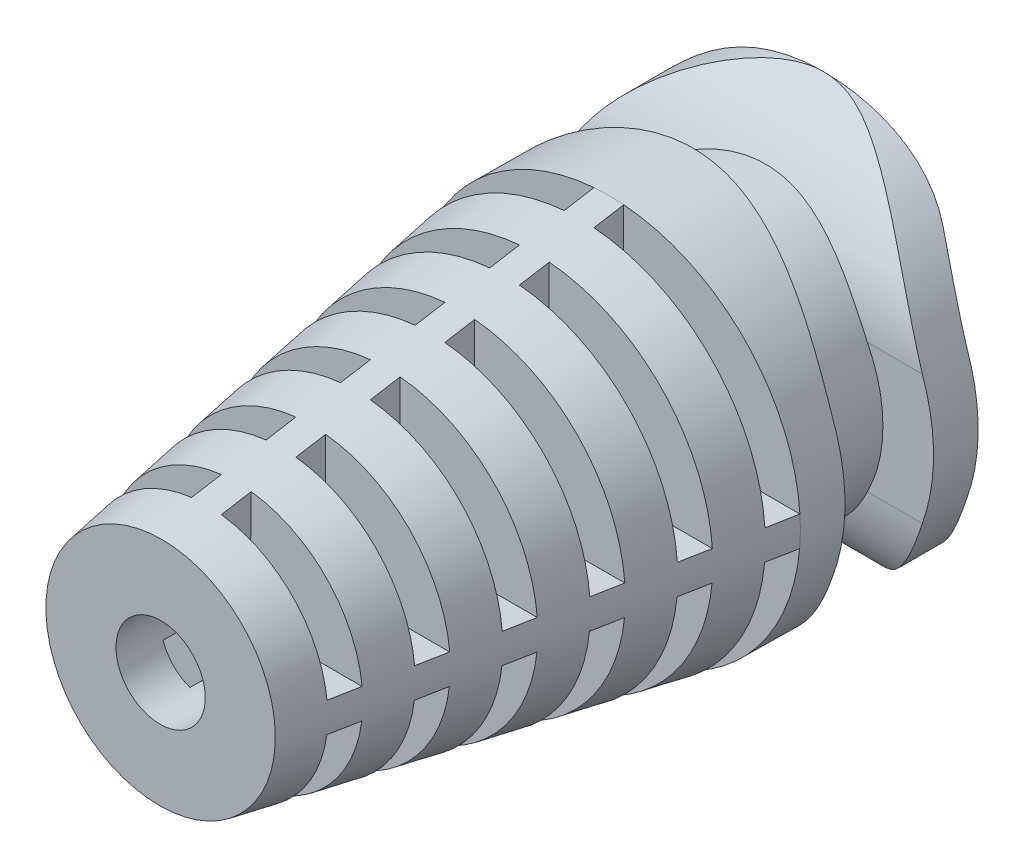
from build123d import *

# Parameters (mm, degrees)
THICKEN1_START           = -53.630580711
THICKEN1_DEPTH           = 13
FILLET1_R                = 4
BOSS_EXTRUDE4_DEPTH      = 3
BOSS_EXTRUDE4_DEPTH_BACK = 1.5
SKETCH12_R               = 4.8
SKETCH11_R               = 10
SKETCH11_R_2             = 6.5
CUT_EXTRUDE1_DEPTH       = 6.5
THICKEN2_START           = -55.130580711
THICKEN2_DEPTH           = 15
SKETCH14_R               = 12.5
SKETCH14_R_2             = 6.5
CUT_EXTRUDE2_DEPTH       = 3
BOSS_EXTRUDE5_START      = -1.169483993
BOSS_EXTRUDE5_OUTLINE_R  = 6.5
BOSS_EXTRUDE5_DEPTH      = 1.169483993
CUT_EXTRUDE3_DEPTH       = 87.600410961
CUT_EXTRUDE3_DEPTH_BACK  = 87.600410961
SKETCH17_R               = 1.5
CUT_EXTRUDE4_DEPTH       = 1
LPATTERN1_COUNT          = 6
LPATTERN1_PITCH          = 2.5


with BuildPart() as part:
    # Thicken1: read off the stored shape, not the designer's step
    # Thicken1 outline → Thicken1 (new body)
    with BuildSketch(Plane.YZ.offset(THICKEN1_START)):
        with BuildLine():
            ThreePointArc((-54.570896053, 96.703918144), (-52.016416657, 95.896556493), (-50.245393537, 93.88641348))
            Line((-50.245393537, 93.88641348), (-50.245393537, 95.38641348))
            ThreePointArc((-50.245393537, 95.38641348), (-52.016416657, 97.396556493), (-54.570896053, 98.203918144))
            Line((-54.570896053, 98.203918144), (-58.91989102, 98.203918144))
            ThreePointArc((-58.91989102, 98.203918144), (-61.474370417, 97.396556493), (-63.245393537, 95.38641348))
            Line((-63.245393537, 95.38641348), (-63.245393537, 93.88641348))
            ThreePointArc((-63.245393537, 93.88641348), (-61.474370417, 95.896556493), (-58.91989102, 96.703918144))
            Line((-58.91989102, 96.703918144), (-54.570896053, 96.703918144))
        make_face()
    extrude(amount=THICKEN1_DEPTH)

    # Fillet1
    # the kernel refuses this fillet: 4 mm, written as the material it takes off along each edge
    with BuildSketch(Plane(origin=(-60.660962633, -63.245393537, 93.88641348), x_dir=(0, 0, 1), z_dir=(1, 0, 0))) as fillet1_piece_1:
        with BuildLine():
            CenterArc((5.494921916, 0.201491658), FILLET1_R, 182.887377366, 28.605190643)
            ThreePointArc((2.084090188, -1.88806019), (1.177516429, -0.794493295), (0, 0))
            Line((0, 0), (1.5, 0))
        make_face()
    extrude(amount=27.060763843, mode=Mode.SUBTRACT)
    with BuildSketch(Plane(origin=(-60.660962633, -50.245393537, 93.88641348), x_dir=(0, -0.671393180122473, 0.7411013410357807), z_dir=(1, 0, 0))) as fillet1_piece_2:
        with BuildLine():
            CenterArc((3.937013876, -3.838578837), FILLET1_R, 106.33274961, 28.605190643)
            Line((1.111652012, -1.00708977), (0, 0))
            ThreePointArc((0, 0), (1.406076384, -0.201776453), (2.812152769, 0))
        make_face()
    extrude(amount=27.060763843, mode=Mode.SUBTRACT)

    # Sketch12 → Boss-Extrude4 (add, two sides: drawn at the far end of the back side and taken through both)
    with BuildSketch(Plane.XY.offset(98.203918144).offset(-BOSS_EXTRUDE4_DEPTH_BACK)):
        with Locations(Location((-47.130580711, -56.745393537, 0), (0, 0, 206.937629603))):
            Circle(SKETCH12_R)
    extrude(amount=BOSS_EXTRUDE4_DEPTH + BOSS_EXTRUDE4_DEPTH_BACK)

    # Sketch11 → Cut-Extrude1 (cut)
    with BuildSketch(Plane.XY.offset(98.203918144)):
        with Locations((-47.130580711, -56.745393537)):
            Circle(SKETCH11_R)
        with Locations((-47.130580711, -56.745393537)):
            Circle(SKETCH11_R_2, mode=Mode.SUBTRACT)
    extrude(amount=-CUT_EXTRUDE1_DEPTH, mode=Mode.SUBTRACT)

    # Thicken2: read off the stored shape, not the designer's step
    # Thicken2 outline → Thicken2 (add)
    with BuildSketch(Plane.YZ.offset(THICKEN2_START)):
        with BuildLine():
            Line((-64.089143537, 101.061538213), (-63.245393537, 99.821342286))
            ThreePointArc((-63.245393537, 99.821342286), (-61.232720422, 100.81046353), (-59.024589511, 101.202090625))
            Line((-59.024589511, 101.202090625), (-54.326705887, 101.154923853))
            ThreePointArc((-54.326705887, 101.154923853), (-52.191809153, 100.747391832), (-50.245393537, 99.780265853))
            Line((-50.245393537, 99.780265853), (-49.401643537, 101.02046178))
            ThreePointArc((-49.401643537, 101.02046178), (-51.728704376, 102.174194103), (-54.281266838, 102.654543244))
            Line((-54.281266838, 102.654543244), (-59.041795723, 102.702338974))
            ThreePointArc((-59.041795723, 102.702338974), (-61.682379399, 102.241570477), (-64.089143537, 101.061538213))
        make_face()
    extrude(amount=THICKEN2_DEPTH)

    # Sketch14 → Cut-Extrude2 (cut)
    with BuildSketch(Plane(origin=(0, 1.025077072, 102.099267319), x_dir=(1, 0, 0), z_dir=(0, 0.010039498209301655, 0.9999496029679223))):
        with Locations((-47.130580711, -57.759351002)):
            Circle(SKETCH14_R)
        with Locations(Location((-47.130580711, -57.759351002, 0), (0, 0, 266.108242128))):
            Circle(SKETCH14_R_2, mode=Mode.SUBTRACT)
    extrude(amount=-CUT_EXTRUDE2_DEPTH, mode=Mode.SUBTRACT)

    # Boss-Extrude5: read off the stored shape, not the designer's step
    # Boss-Extrude5 outline → Boss-Extrude5 (add)
    with BuildSketch(Plane(origin=(0, 1.025077072, 102.099267319), x_dir=(1, 0, 0), z_dir=(0, 0.010039498209301655, 0.9999496029679223)).offset(BOSS_EXTRUDE5_START)):
        with Locations((-47.130580711, -57.759351002)):
            Circle(BOSS_EXTRUDE5_OUTLINE_R)
    extrude(amount=BOSS_EXTRUDE5_DEPTH)

    # Boss-Extrude5 2 outline → Boss-Extrude5 2 (revolve)
    with BuildSketch(Plane(origin=(-47.130580711, -57.756440102, 0.579874901), x_dir=(1, 0, 0), z_dir=(0, -0.9999496029679223, 0.010039498209301704))):
        Polygon((6.5, 102.104413079), (3.855095289, 117.104413079), (0, 117.104413079), (0, 102.104413079), align=None)
    revolve(axis=Axis((-47.130580711, -57.756440102, 0.579874901), (0, 0.010039498209301704, 0.9999496029679223)))

    # Sketch17 → Cut-Extrude3 (cut, two sides: drawn at the far end of the back side and taken through both)
    with BuildSketch(Plane(origin=(0, 1.175669545, 117.098511364), x_dir=(1, 0, 0), z_dir=(0, 0.010039498209301652, 0.9999496029679222)).offset(-CUT_EXTRUDE3_DEPTH_BACK)):
        with Locations(Location((-47.130580711, -57.759351002, 0), (0, 0, 270))):
            Circle(SKETCH17_R)
    extrude(amount=CUT_EXTRUDE3_DEPTH + CUT_EXTRUDE3_DEPTH_BACK, mode=Mode.SUBTRACT)

    # Sketch20 → Cut-Extrude4 (cut)
    with BuildSketch(Plane(origin=(0, 1.025077072, 102.099267319), x_dir=(-1, 0, 0), z_dir=(0, -0.010039498209300883, -0.9999496029679222))):
        with BuildLine():
            Line((47.630580711, -50.77723098), (47.630580711, -56.505357381))
            ThreePointArc((47.630580711, -56.505357381), (48.085174866, -56.804756847), (48.384574332, -57.259351002))
            Line((48.384574332, -57.259351002), (54.112700733, -57.259351002))
            ThreePointArc((54.112700733, -57.259351002), (52.08032818, -52.809603533), (47.630580711, -50.77723098))
        make_face()
        with BuildLine():
            Line((47.630580711, -59.013344622), (47.630580711, -64.741471023))
            ThreePointArc((47.630580711, -64.741471023), (52.08032818, -62.70909847), (54.112700733, -58.259351002))
            Line((54.112700733, -58.259351002), (48.384574332, -58.259351002))
            ThreePointArc((48.384574332, -58.259351002), (48.085174866, -58.713945156), (47.630580711, -59.013344622))
        make_face()
        with BuildLine():
            Line((45.876587091, -58.259351002), (40.148460689, -58.259351002))
            ThreePointArc((40.148460689, -58.259351002), (42.180833243, -62.70909847), (46.630580711, -64.741471023))
            Line((46.630580711, -64.741471023), (46.630580711, -59.013344622))
            ThreePointArc((46.630580711, -59.013344622), (46.175986557, -58.713945156), (45.876587091, -58.259351002))
        make_face()
        with BuildLine():
            Line((46.630580711, -56.505357381), (46.630580711, -50.77723098))
            ThreePointArc((46.630580711, -50.77723098), (42.180833243, -52.809603533), (40.148460689, -57.259351002))
            Line((40.148460689, -57.259351002), (45.876587091, -57.259351002))
            ThreePointArc((45.876587091, -57.259351002), (46.175986557, -56.804756847), (46.630580711, -56.505357381))
        make_face()
    cut_extrude4 = extrude(amount=-CUT_EXTRUDE4_DEPTH, mode=Mode.SUBTRACT)

    # LPattern1: Cut-Extrude4 ×6
    with Locations(*[Vector(0, 0.010039498209302184, 0.9999496029679223) * (i * LPATTERN1_PITCH) for i in range(1, LPATTERN1_COUNT)]):
        add(cut_extrude4, mode=Mode.SUBTRACT)


solid = part.part
